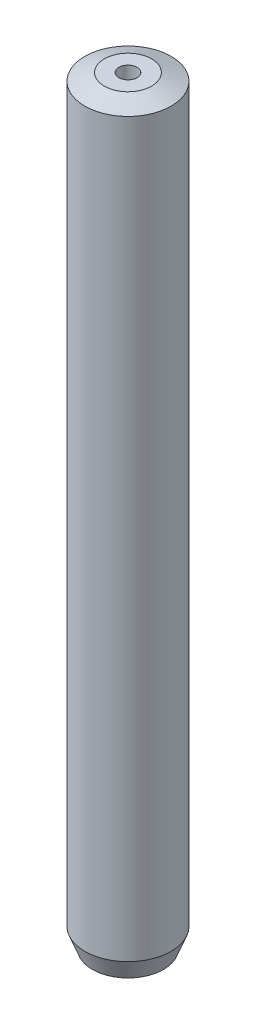
from build123d import *
from OCP.BRepFilletAPI import BRepFilletAPI_MakeChamfer

# Parameters (mm, degrees)
SKETCH1_R           = 5
BOSS_EXTRUDE1_DEPTH = 87.956111101
SKETCH2_R           = 1.050461191
CUT_EXTRUDE1_DEPTH  = 89.239885992
CHAMFER1_SIZE       = 0.877063388
CHAMFER1_SIZE2      = 2.260265416


with BuildPart() as part:
    # Sketch1 → Boss-Extrude1 (new body)
    with BuildSketch(Plane(origin=(0, 0, 0), x_dir=(1, 0, 0), z_dir=(0, 1, 0))):
        Circle(SKETCH1_R)
    extrude(amount=BOSS_EXTRUDE1_DEPTH)

    # Sketch2 → Cut-Extrude1 (cut, through all)
    with BuildSketch(Plane(origin=(0, 0, 0), x_dir=(1, 0, 0), z_dir=(0, 1, 0))):
        Circle(SKETCH2_R)
    extrude(amount=CUT_EXTRUDE1_DEPTH, mode=Mode.SUBTRACT)

    # Chamfer1: one chamfer whose edges measure the first distance from different faces: ONE call of the kernel's chamfer builder (chamfer() names one face for all edges)
    chamfer1_edges_1 = [part.edges().sort_by_distance(p)[0] for p in [
        (-5, 87.956111101, 0),
    ]]
    chamfer1_side_1 = [part.faces().sort_by_distance(p)[0] for p in [
        (-5, 43.97805555, 0),
    ]]
    chamfer1_edges_2 = [part.edges().sort_by_distance(p)[0] for p in [
        (-5, 0, 0),
    ]]
    chamfer1_side_2 = [part.faces().sort_by_distance(p)[0] for p in [
        (-4.858578644, 0, 0),
    ]]
    chamfer1 = BRepFilletAPI_MakeChamfer(part.part.solid().wrapped)
    for e in chamfer1_edges_1:
        chamfer1.Add(CHAMFER1_SIZE, CHAMFER1_SIZE2, e.wrapped, chamfer1_side_1[0].wrapped)  # the first distance lies on this face
    for e in chamfer1_edges_2:
        chamfer1.Add(CHAMFER1_SIZE, CHAMFER1_SIZE2, e.wrapped, chamfer1_side_2[0].wrapped)  # the first distance lies on this face
    add(Compound.cast(chamfer1.Shape()), mode=Mode.REPLACE)


solid = part.part
